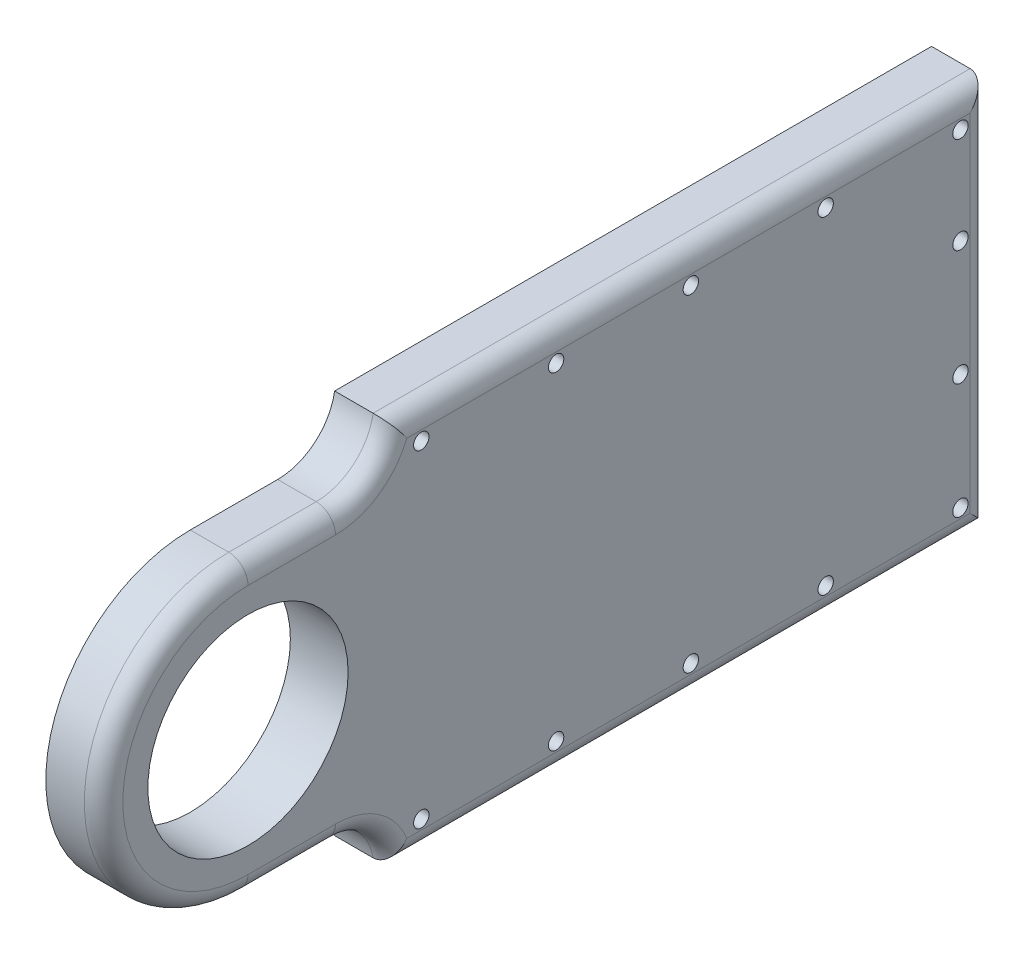
from build123d import *

# Parameters (mm, degrees)
SKETCH1_W           = 155
SKETCH1_H           = 100
BOSS_EXTRUDE1_DEPTH = 15
SKETCH2_W           = 15
SKETCH2_H           = 75
BOSS_EXTRUDE2_DEPTH = 75
SKETCH3_R           = 26
CUT_EXTRUDE1_DEPTH  = 75
CUT_EXTRUDE2_START  = -15
CUT_EXTRUDE2_DEPTH  = 15
FILLET1_R           = 15
SKETCH5_R           = 2
CUT_EXTRUDE3_DEPTH  = 186.067555233
FILLET7_R           = 5


# Read off the part's stored shape, not the designer's step: Cut-Extrude2
with BuildPart() as part:
    # Sketch1 → Boss-Extrude1 (new body)
    with BuildSketch(Plane(origin=(0, 0, 0), x_dir=(0, 0, -1), z_dir=(1, 0, 0))):
        with Locations((77.5, 50)):
            Rectangle(SKETCH1_W, SKETCH1_H)
    extrude(amount=BOSS_EXTRUDE1_DEPTH)

    # Sketch2 → Boss-Extrude2 (add)
    with BuildSketch(Plane.XY):
        with Locations((7.5, 50)):
            Rectangle(SKETCH2_W, SKETCH2_H)
    extrude(amount=BOSS_EXTRUDE2_DEPTH)

    # Sketch3 → Cut-Extrude1 (cut)
    with BuildSketch(Plane(origin=(15, 0, 0), x_dir=(0, 0, -1), z_dir=(1, 0, 0))):
        with Locations((-37.5, 50)):
            Circle(SKETCH3_R)
    extrude(amount=-CUT_EXTRUDE1_DEPTH, mode=Mode.SUBTRACT)

    # Cut-Extrude2 outline → Cut-Extrude2 (cut)
    with BuildSketch(Plane(origin=(15, 0, 0), x_dir=(0, 0, -1), z_dir=(1, 0, 0)).offset(CUT_EXTRUDE2_START)):
        with BuildLine():
            Line((-75, 12.5), (-37.5, 12.5))
            ThreePointArc((-37.5, 12.5), (-64.016504294, 23.483495706), (-75, 50))
            Line((-75, 50), (-75, 12.5))
        make_face()
        with BuildLine():
            Line((-75, 87.5), (-75, 50))
            ThreePointArc((-75, 50), (-64.016504294, 76.516504294), (-37.5, 87.5))
            Line((-37.5, 87.5), (-75, 87.5))
        make_face()
    extrude(amount=CUT_EXTRUDE2_DEPTH, mode=Mode.SUBTRACT)

    # Fillet1
    # the kernel refuses this fillet: 15 mm, written as the material it adds along each edge
    with BuildSketch(Plane(origin=(15, 12.5, 0), x_dir=(0, -1, 0), z_dir=(-1, 0, 0))) as fillet1_piece_1:
        with BuildLine():
            CenterArc((15, 14.790199458), FILLET1_R, 180, 80.405931773)
            Line((0, 14.790199458), (-0.3, 14.790199458))
            Line((-0.3, 14.790199458), (-0.3, 0))
            Line((-0.3, 0), (0, -0.3))
            ThreePointArc((0, -0.3), (6.25, -0.3), (12.45, -0.295803989))
            Line((12.45, -0.295803989), (12.5, 0))
        make_face()
    extrude(amount=15)
    with BuildSketch(Plane(origin=(0, 87.5, 0), x_dir=(0, 0, 1), z_dir=(1, 0, 0))) as fillet1_piece_2:
        with BuildLine():
            CenterArc((14.790199458, -15), FILLET1_R, 90, 80.405931773)
            Line((0, -12.5), (-0.295803989, -12.45))
            ThreePointArc((-0.295803989, -12.45), (-0.3, -6.25), (-0.3, 0))
            Line((-0.3, 0), (0, 0.3))
            Line((0, 0.3), (14.790199458, 0.3))
            Line((14.790199458, 0.3), (14.790199458, 0))
        make_face()
    extrude(amount=15)

    # Sketch5 → Cut-Extrude3 (cut, through all)
    with BuildSketch(Plane.ZY):
        with Locations((-147.5, 92.5)):
            Circle(SKETCH5_R)
        with Locations((-112.5, 92.5)):
            Circle(SKETCH5_R)
        with Locations((-77.5, 92.5)):
            Circle(SKETCH5_R)
        with Locations((-42.5, 92.5)):
            Circle(SKETCH5_R)
        with Locations((-7.5, 92.5)):
            Circle(SKETCH5_R)
        with Locations(Location((-7.5, 7.5, 0), (0, 0, 180))):
            Circle(SKETCH5_R)
        with Locations(Location((-42.5, 7.5, 0), (0, 0, 180))):
            Circle(SKETCH5_R)
        with Locations(Location((-77.5, 7.5, 0), (0, 0, 180))):
            Circle(SKETCH5_R)
        with Locations(Location((-112.5, 7.5, 0), (0, 0, 180))):
            Circle(SKETCH5_R)
        with Locations(Location((-147.5, 7.5, 0), (0, 0, 180))):
            Circle(SKETCH5_R)
        with Locations(Location((-147.5, 37.5, 0), (0, 0, 180))):
            Circle(SKETCH5_R)
        with Locations(Location((-147.5, 67.5, 0), (0, 0, 180))):
            Circle(SKETCH5_R)
    extrude(amount=-CUT_EXTRUDE3_DEPTH, mode=Mode.SUBTRACT)

    # Fillet7
    fillet7_edges = [part.edges().sort_by_distance(p)[0] for p in [
        (15, 50, -155),
        (15, 100, -77.5),
        (15, 12.5, 26.145099729),
        (15, 87.5, 26.145099729),
        (15, 76.516504294, 64.016504294),
        (15, 8.956439237, 5.107741092),
        (15, 91.043560763, 5.107741092),
        (15, 0, -77.5),
    ]]
    fillet(fillet7_edges, radius=FILLET7_R)


solid = part.part
